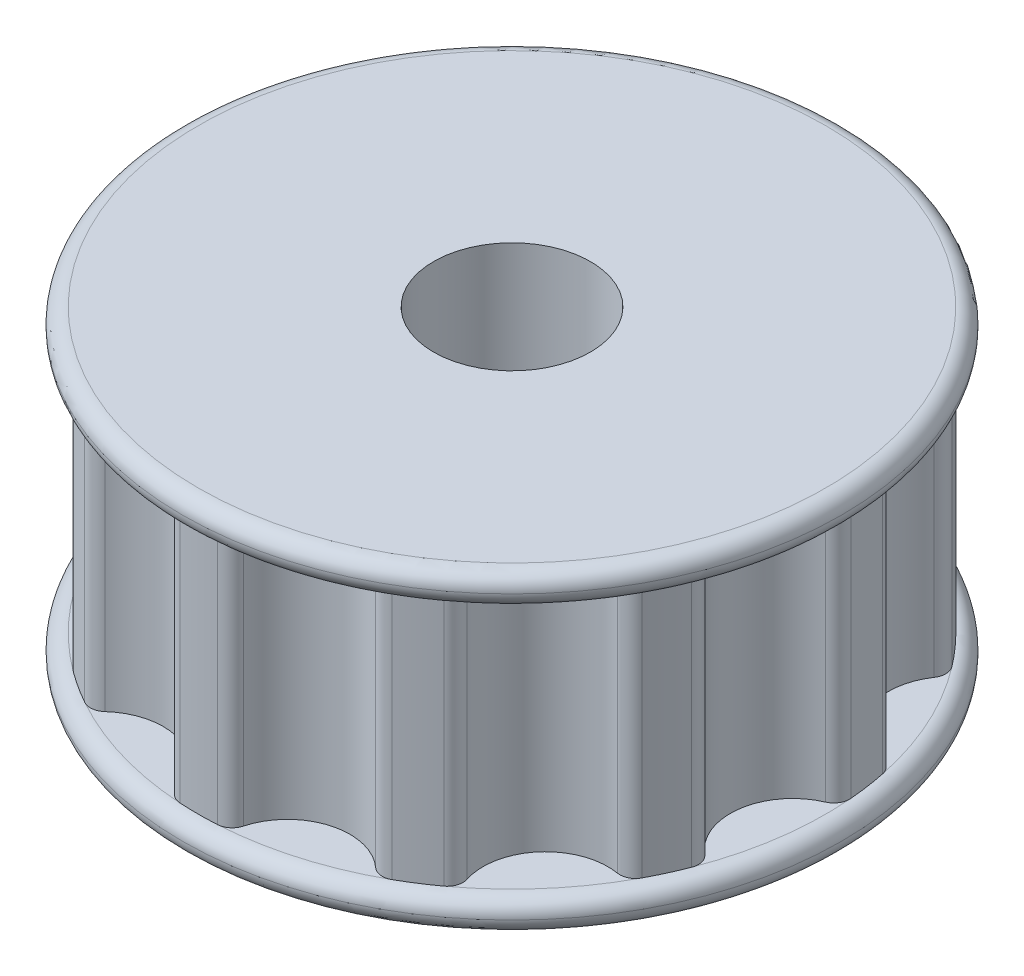
from build123d import *

# Parameters (mm, degrees)
EXTRUDE_3_DEPTH     = 8
SKETCH_4_R          = 10.5
EXTRUDE_4_DEPTH     = 1
EXTRUDE_START       = 1
SKETCH_5_R          = 10.5
EXTRUDE_5_DEPTH     = 1
FILLET_1_R          = 0.5
FILLET_2_R          = 0.5
SKETCH_6_R          = 2.5
CUT_EXTRUDE_1_DEPTH = 18.902513907
SKETCH_15_R         = 1.5
CUT_EXTRUDE_3_DEPTH = 9


with BuildPart() as part:
    # 草图1 → 凸台-拉伸3 (new body)
    with BuildSketch(Plane(origin=(0, 0, 0), x_dir=(1, 0, 0), z_dir=(0, 1, 0))):
        with BuildLine():
            ThreePointArc((-2.238703662, 9.746189302), (-2.817325568, 9.594929736), (-3.385870387, 9.40935076))
            ThreePointArc((-3.385870387, 9.40935076), (-3.628927824, 9.221667042), (-3.716443023, 8.927314896))
            ThreePointArc((-3.716443023, 8.927314896), (-4.630821169, 7.205698391), (-6.576705035, 7.089136117))
            ThreePointArc((-6.576705035, 7.089136117), (-6.880812292, 7.131807792), (-7.152505116, 6.988681604))
            ThreePointArc((-7.152505116, 6.988681604), (-7.557495744, 6.548607339), (-7.935454511, 6.085109835))
            ThreePointArc((-7.935454511, 6.085109835), (-8.03845796, 5.795813472), (-7.952941646, 5.500874401))
            ThreePointArc((-7.952941646, 5.500874401), (-7.791389337, 3.558208286), (-9.36535269, 2.408125617))
            ThreePointArc((-9.36535269, 2.408125617), (-9.644254044, 2.279610518), (-9.795436733, 2.012316877))
            ThreePointArc((-9.795436733, 2.012316877), (-9.898214419, 1.423148383), (-9.965587898, 0.828889532))
            ThreePointArc((-9.965587898, 0.828889532), (-9.895834491, 0.529830076), (-9.664437489, 0.327945151))
            ThreePointArc((-9.664437489, 0.327945151), (-8.478246441, -1.218987809), (-9.180567039, -3.037447752))
            ThreePointArc((-9.180567039, -3.037447752), (-9.34571328, -3.296346989), (-9.328386398, -3.602944241))
            ThreePointArc((-9.328386398, -3.602944241), (-9.096319954, -4.15415013), (-8.83171754, -4.69049734))
            ThreePointArc((-8.83171754, -4.69049734), (-8.611353491, -4.904370625), (-8.307542715, -4.949104368))
            ThreePointArc((-8.307542715, -4.949104368), (-6.473320205, -5.609163888), (-6.081016219, -7.518652921))
            ThreePointArc((-6.081016219, -7.518652921), (-6.079974583, -7.825737617), (-5.899639294, -8.074296019))
            ThreePointArc((-5.899639294, -8.074296019), (-5.406408175, -8.412535328), (-4.893839265, -8.720684448))
            ThreePointArc((-4.893839265, -8.720684448), (-4.592828603, -8.781468305), (-4.313061827, -8.654848218))
            ThreePointArc((-4.313061827, -8.654848218), (-2.413160542, -8.218470064), (-1.050785716, -9.612738911))
            ThreePointArc((-1.050785716, -9.612738911), (-0.883886915, -9.870511846), (-0.597798398, -9.982115862))
            ThreePointArc((-0.597798398, -9.982115862), (0, -10), (0.597798398, -9.982115862))
            ThreePointArc((0.597798398, -9.982115862), (0.883886915, -9.870511846), (1.050785716, -9.612738911))
            ThreePointArc((1.050785716, -9.612738911), (2.413160542, -8.218470064), (4.313061827, -8.654848218))
            ThreePointArc((4.313061827, -8.654848218), (4.592828603, -8.781468305), (4.893839265, -8.720684448))
            ThreePointArc((4.893839265, -8.720684448), (5.406408175, -8.412535328), (5.899639294, -8.074296019))
            ThreePointArc((5.899639294, -8.074296019), (6.079974583, -7.825737617), (6.081016219, -7.518652921))
            ThreePointArc((6.081016219, -7.518652921), (6.473320205, -5.609163888), (8.307542715, -4.949104368))
            ThreePointArc((8.307542715, -4.949104368), (8.611353491, -4.904370625), (8.83171754, -4.69049734))
            ThreePointArc((8.83171754, -4.69049734), (9.096319954, -4.15415013), (9.328386398, -3.602944241))
            ThreePointArc((9.328386398, -3.602944241), (9.34571328, -3.296346989), (9.180567039, -3.037447752))
            ThreePointArc((9.180567039, -3.037447752), (8.478246441, -1.218987809), (9.664437489, 0.327945151))
            ThreePointArc((9.664437489, 0.327945151), (9.895834491, 0.529830076), (9.965587898, 0.828889532))
            ThreePointArc((9.965587898, 0.828889532), (9.898214419, 1.423148383), (9.795436733, 2.012316877))
            ThreePointArc((9.795436733, 2.012316877), (9.644254044, 2.279610518), (9.36535269, 2.408125617))
            ThreePointArc((9.36535269, 2.408125617), (7.791389337, 3.558208286), (7.952941646, 5.500874401))
            ThreePointArc((7.952941646, 5.500874401), (8.03845796, 5.795813472), (7.935454511, 6.085109835))
            ThreePointArc((7.935454511, 6.085109835), (7.557495744, 6.548607339), (7.152505116, 6.988681604))
            ThreePointArc((7.152505116, 6.988681604), (6.880812292, 7.131807792), (6.576705035, 7.089136117))
            ThreePointArc((6.576705035, 7.089136117), (4.630821169, 7.205698391), (3.716443023, 8.927314896))
            ThreePointArc((3.716443023, 8.927314896), (3.628927824, 9.221667042), (3.385870387, 9.40935076))
            ThreePointArc((3.385870387, 9.40935076), (2.817325568, 9.594929736), (2.238703662, 9.746189302))
            ThreePointArc((2.238703662, 9.746189302), (1.932761255, 9.719706483), (1.7, 9.519395989))
            ThreePointArc((1.7, 9.519395989), (0, 8.56543017), (-1.7, 9.519395989))
            ThreePointArc((-1.7, 9.519395989), (-1.932761255, 9.719706483), (-2.238703662, 9.746189302))
        make_face()
    extrude(amount=EXTRUDE_3_DEPTH)

    # 草图4 → 凸台-拉伸4 (add)
    with BuildSketch(Plane.XZ):
        with Locations(Location((0, 0, 0), (0, 0, 270))):
            Circle(SKETCH_4_R)
    extrude(amount=EXTRUDE_4_DEPTH)

    # 草图5 → 凸台-拉伸5 (add)
    with BuildSketch(Plane(origin=(0, 8, 0), x_dir=(1, 0, 0), z_dir=(0, 1, 0)).offset(EXTRUDE_START)):
        with Locations(Location((0, 0, 0), (0, 0, 90))):
            Circle(SKETCH_5_R)
    extrude(amount=-EXTRUDE_5_DEPTH)

    # 圆角1
    fillet_1_edges = [part.edges().sort_by_distance(p)[0] for p in [
        (0, 0, 10.5),
        (0, -1, 10.5),
    ]]
    fillet(fillet_1_edges, radius=FILLET_1_R - 0.0001)  # a hair under: the kernel refuses the full size

    # 圆角2
    fillet_2_edges = [part.edges().sort_by_distance(p)[0] for p in [
        (0, 8, 10.5),
        (0, 9, 10.5),
    ]]
    fillet(fillet_2_edges, radius=FILLET_2_R - 0.0001)  # a hair under: the kernel refuses the full size

    # 草图6 → 切除-拉伸1 (cut, through all)
    with BuildSketch(Plane(origin=(0, 9, 0), x_dir=(1, 0, 0), z_dir=(0, 1, 0))):
        with Locations(Location((0, 0, 0), (0, 0, 270))):
            Circle(SKETCH_6_R)
    extrude(amount=-CUT_EXTRUDE_1_DEPTH, mode=Mode.SUBTRACT)

    # 草图15 → 切除-拉伸3 (cut)
    with BuildSketch(Plane.XY.offset(-10)):
        with Locations(Location((0, 4.216357154, 0), (0, 0, 180))):
            Circle(SKETCH_15_R)
    extrude(amount=CUT_EXTRUDE_3_DEPTH, mode=Mode.SUBTRACT)


solid = part.part
